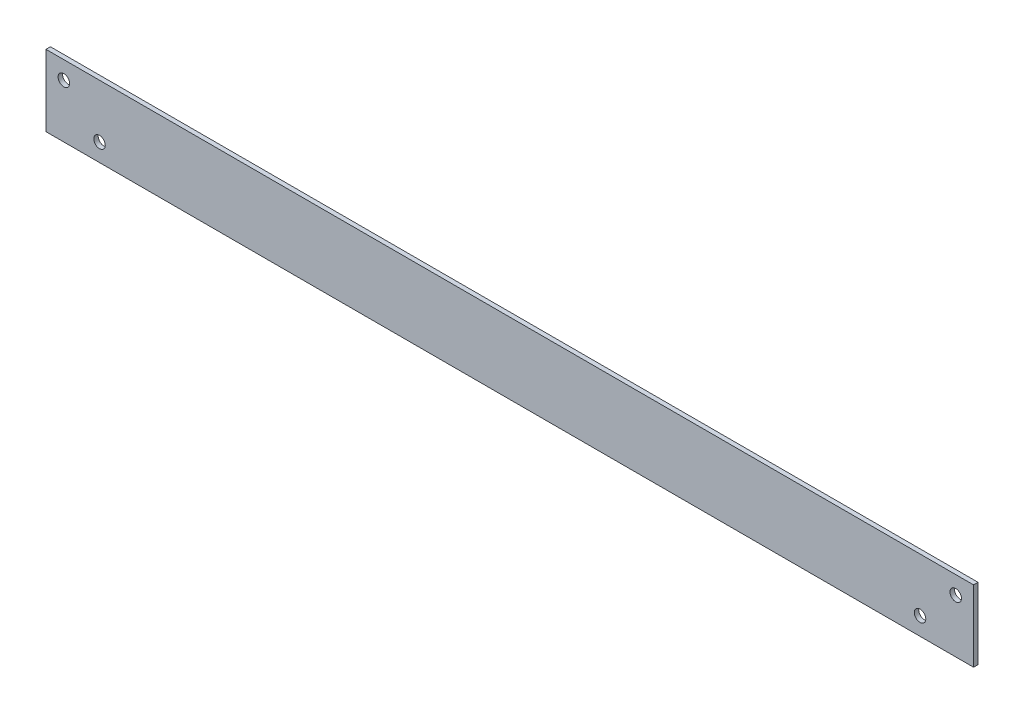
from build123d import *

# Parameters (mm, degrees)
SKETCH1_W           = 330.2
SKETCH1_H           = 25.4
SKETCH1_R           = 2.05
BOSS_EXTRUDE1_DEPTH = 1.5875


with BuildPart() as part:
    # Sketch1 → Boss-Extrude1 (new body)
    with BuildSketch(Plane.XY):
        Rectangle(SKETCH1_W, SKETCH1_H)
        with Locations((-146.05, -6.35)):
            Circle(SKETCH1_R, mode=Mode.SUBTRACT)
        with Locations((-158.75, 6.35)):
            Circle(SKETCH1_R, mode=Mode.SUBTRACT)
        with Locations((158.75, 6.35)):
            Circle(SKETCH1_R, mode=Mode.SUBTRACT)
        with Locations((146.05, -6.35)):
            Circle(SKETCH1_R, mode=Mode.SUBTRACT)
    extrude(amount=BOSS_EXTRUDE1_DEPTH)


solid = part.part
